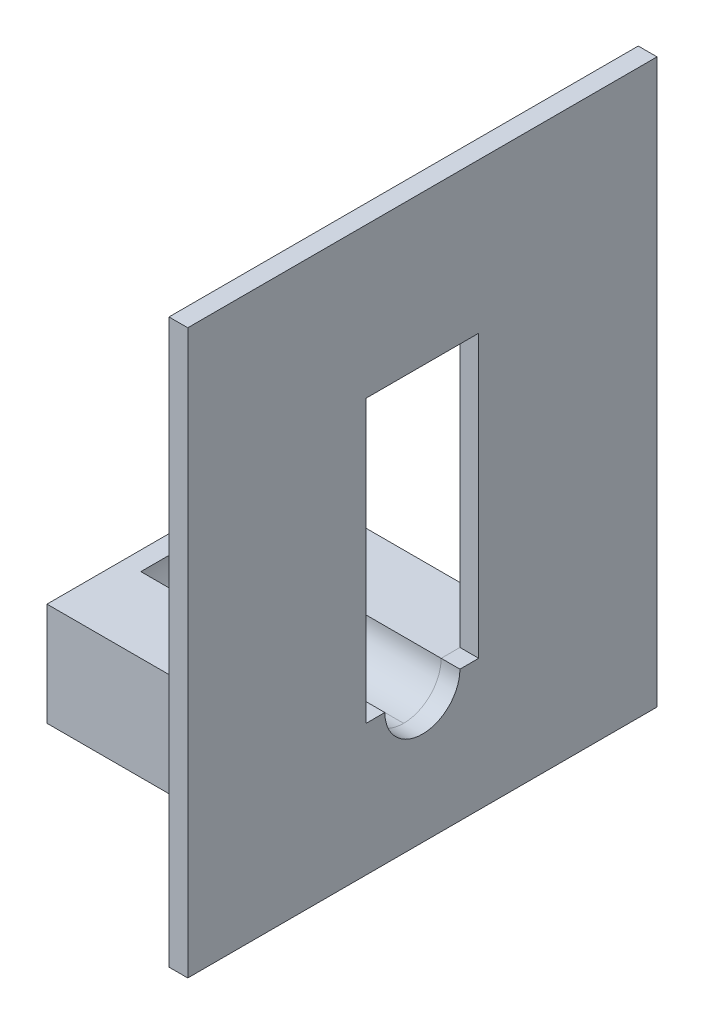
from build123d import *

# Parameters (mm, degrees)
SKETCH1_W           = 13
SKETCH1_H           = 12
BOSS_EXTRUDE1_DEPTH = 2.5
SKETCH2_W           = 13
SKETCH2_H           = 2
BOSS_EXTRUDE2_DEPTH = 3
SKETCH3_W           = 12
SKETCH3_H           = 4
CUT_EXTRUDE2_DEPTH  = 2
FILLET1_R           = 2
SKETCH4_W           = 25
SKETCH4_H           = 30
BOSS_EXTRUDE5_DEPTH = 1


with BuildPart() as part:
    # Sketch1 → Boss-Extrude1 (new body)
    with BuildSketch(Plane(origin=(0, 0, 0), x_dir=(1, 0, 0), z_dir=(0, 1, 0))):
        Rectangle(SKETCH1_W, SKETCH1_H)
    extrude(amount=BOSS_EXTRUDE1_DEPTH)

    # Sketch2 → Boss-Extrude2 (add)
    with BuildSketch(Plane.XZ):
        with Locations((0, 5)):
            Rectangle(SKETCH2_W, SKETCH2_H)
        with Locations((0, -5)):
            Rectangle(SKETCH2_W, SKETCH2_H)
    extrude(amount=BOSS_EXTRUDE2_DEPTH)

    # Sketch3 → Cut-Extrude2 (cut)
    with BuildSketch(Plane(origin=(0, 2.5, 0), x_dir=(1, 0, 0), z_dir=(0, 1, 0))):
        with Locations((0.5, 0)):
            Rectangle(SKETCH3_W, SKETCH3_H)
    extrude(amount=-CUT_EXTRUDE2_DEPTH, mode=Mode.SUBTRACT)

    # Fillet1
    fillet1_edges = [part.edges().sort_by_distance(p)[0] for p in [
        (0.5, 0.5, 2),
        (0.5, 0.5, -2),
        (-5.5, 0.5, 0),
    ]]
    fillet(fillet1_edges, radius=FILLET1_R - 0.0001)  # a hair under: the kernel refuses the full size


with BuildPart() as body_2:
    # Sketch4 → Boss-Extrude5 (new body)
    with BuildSketch(Plane(origin=(6.5, 0, 0), x_dir=(0, 0, -1), z_dir=(1, 0, 0))):
        with Locations((0, 10.5)):
            Rectangle(SKETCH4_W, SKETCH4_H)
        with BuildLine():
            Line((-3, 2.5), (-3, 17.5))
            Line((-3, 17.5), (3, 17.5))
            Line((3, 17.5), (3, 2.5))
            Line((3, 2.5), (2, 2.5))
            ThreePointArc((2, 2.5), (0, 0.5), (-2, 2.5))
            Line((-2, 2.5), (-3, 2.5))
        make_face(mode=Mode.SUBTRACT)
    extrude(amount=BOSS_EXTRUDE5_DEPTH)


solid = Compound([part.part, body_2.part])
